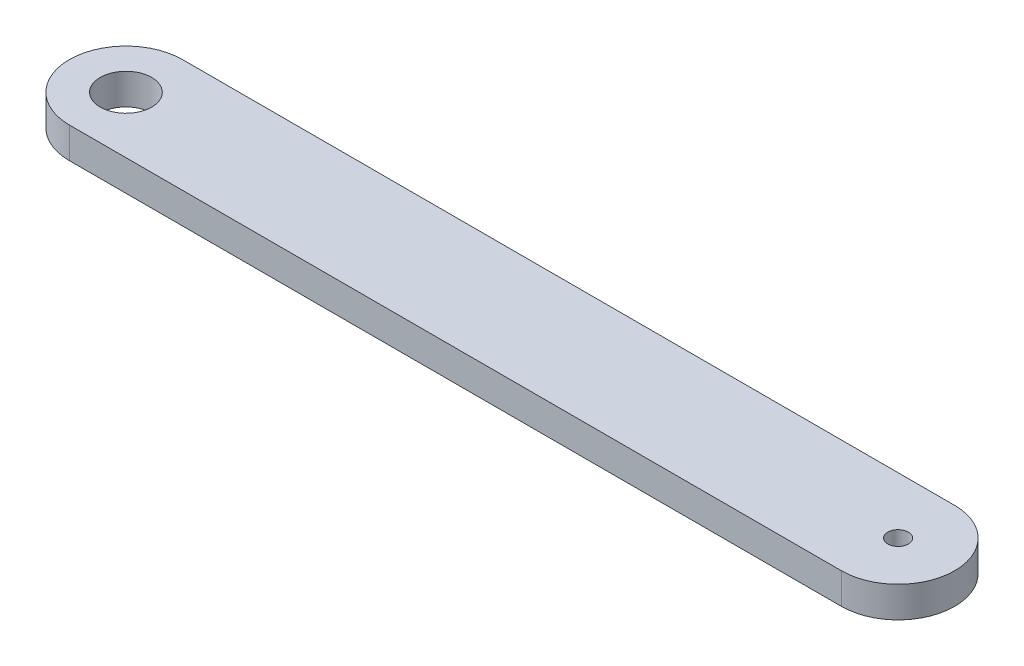
from build123d import *

# Parameters (mm, degrees)
SKETCH2_R           = 2
SKETCH2_R_2         = 5
BOSS_EXTRUDE1_DEPTH = 6


with BuildPart() as part:
    # Sketch2 → Boss-Extrude1 (new body)
    with BuildSketch(Plane(origin=(0, 0, 0), x_dir=(1, 0, 0), z_dir=(0, 1, 0))):
        with BuildLine():
            Line((75, -11), (-75, -11))
            ThreePointArc((-75, -11), (-86, 0), (-75, 11))
            Line((-75, 11), (75, 11))
            ThreePointArc((75, 11), (86, 0), (75, -11))
        make_face()
        with Locations((75, 0)):
            Circle(SKETCH2_R, mode=Mode.SUBTRACT)
        with Locations((-75, 0)):
            Circle(SKETCH2_R_2, mode=Mode.SUBTRACT)
    extrude(amount=BOSS_EXTRUDE1_DEPTH)


solid = part.part
